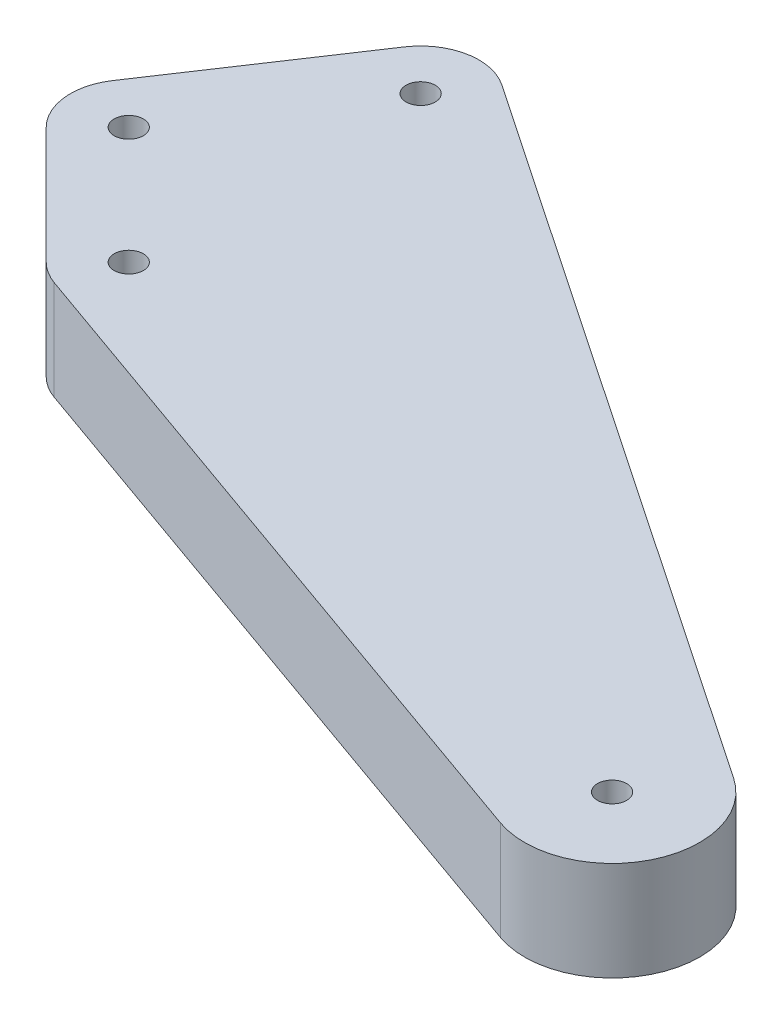
from build123d import *

# Parameters (mm, degrees)
BOSS_EXTRUDE1_DEPTH = 17
SKETCH2_R           = 2.5
CUT_EXTRUDE1_DEPTH  = 149.707767114


with BuildPart() as part:
    # Sketch1 → Boss-Extrude1 (new body)
    with BuildSketch(Plane(origin=(0, 0, 0), x_dir=(1, 0, 0), z_dir=(0, 1, 0))):
        with BuildLine():
            Line((5.602489683, 58.283242683), (128.403734525, -24.775135975))
            ThreePointArc((128.403734525, -24.775135975), (133.390125226, -43.960513769), (114.991833807, -51.339245785))
            Line((114.991833807, -51.339245785), (-3.338777462, -9.426163857))
            ThreePointArc((-3.338777462, -9.426163857), (-5.336463155, -8.457077568), (-7.071067812, -7.071067812))
            Line((-7.071067812, -7.071067812), (-27.071067812, 12.928932188))
            ThreePointArc((-27.071067812, 12.928932188), (-29.951333267, 19.01462382), (-28.320502943, 25.547001962))
            Line((-28.320502943, 25.547001962), (-8.320502943, 55.547001962))
            ThreePointArc((-8.320502943, 55.547001962), (-1.928380756, 59.81230593), (5.602489683, 58.283242683))
        make_face()
    extrude(amount=BOSS_EXTRUDE1_DEPTH)

    # Sketch2 → Cut-Extrude1 (cut, through all)
    with BuildSketch(Plane(origin=(0, 17, 0), x_dir=(1, 0, 0), z_dir=(0, 1, 0))):
        with Locations((0, 50)):
            Circle(SKETCH2_R)
        Circle(SKETCH2_R)
        with Locations((120, -37.2)):
            Circle(SKETCH2_R)
        with Locations((-20, 20)):
            Circle(SKETCH2_R)
    extrude(amount=-CUT_EXTRUDE1_DEPTH, mode=Mode.SUBTRACT)


solid = part.part
